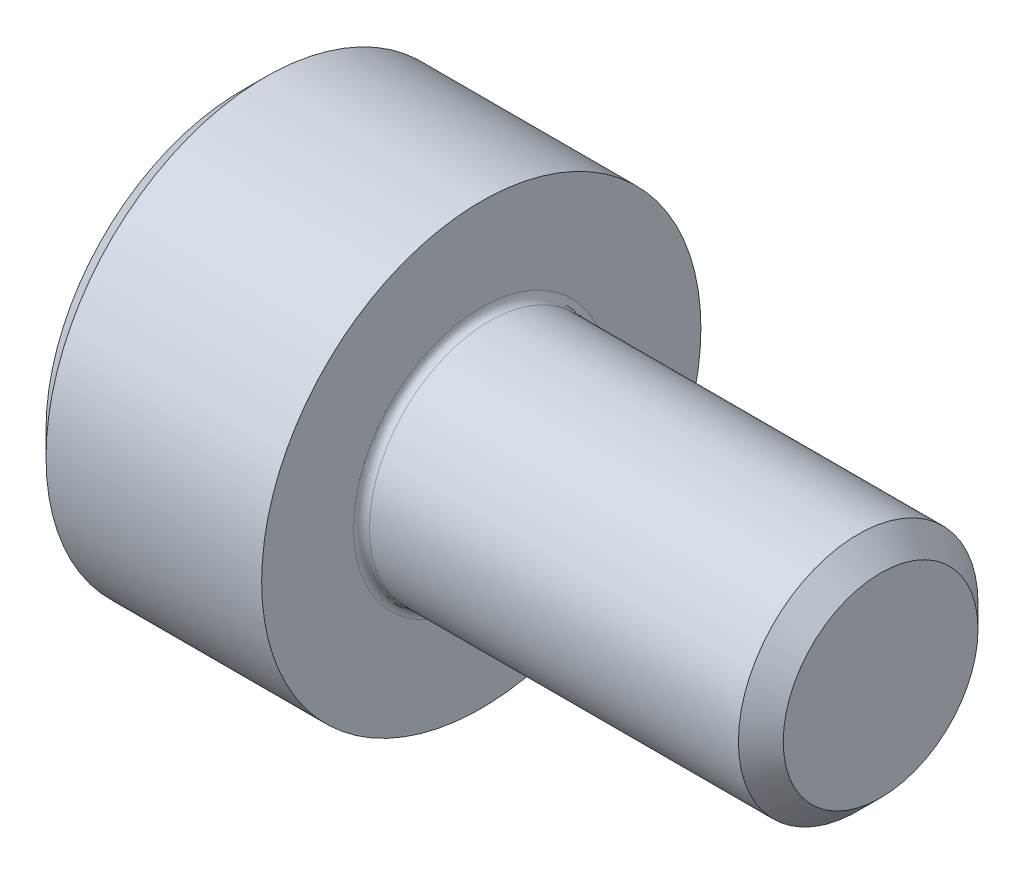
from build123d import *

# Parameters (mm, degrees)
FILLET1_R   = 0.1
HEX_2_DEPTH = 1.3


with BuildPart() as part:
    # BodySke → Base-Revolve (revolve)
    with BuildSketch(Plane.XY):
        Polygon((0, 0), (0, 2.45), (0.3, 2.75), (3, 2.75), (3, 1.5), (7.7195, 1.5), (8, 1.2195), (8, 0), align=None)
    revolve(axis=Axis((-31.75, 0, 0), (1, 0, 0)))

    # Fillet1
    fillet1_edges = [part.edges().sort_by_distance(p)[0] for p in [
        (3, -1.5, 0),
    ]]
    fillet(fillet1_edges, radius=FILLET1_R)

    # Sketch2 → Hex-PreBroach (revolve, cut)
    with BuildSketch(Plane.XY):
        Polygon((0, 1.28), (1.3, 1.28), (2.039008345, 0), (0, 0), align=None)
    revolve(axis=Axis((0, 0, 0), (1, 0, 0)), mode=Mode.SUBTRACT)

    # Sketch3 → Hex 2 (cut)
    with BuildSketch(Plane(origin=(0, 0, 0), x_dir=(0, 0.500000000000001, 0.866025403784438), z_dir=(-1, 0, 0))):
        Polygon((0.739008345, 1.28), (-0.739008345, 1.28), (-1.478016689, 0), (-0.739008345, -1.28), (0.739008345, -1.28), (1.478016689, 0), align=None)
    extrude(amount=-HEX_2_DEPTH, mode=Mode.SUBTRACT)


solid = part.part
